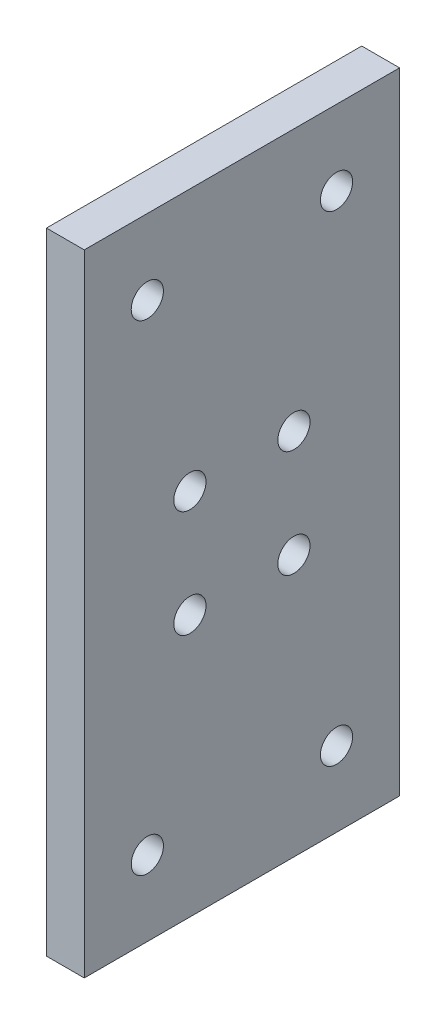
from build123d import *

# Parameters (mm, degrees)
SKETCH1_W           = 100
SKETCH1_H           = 50
SKETCH1_R           = 2.555
BOSS_EXTRUDE1_DEPTH = 6


with BuildPart() as part:
    # Sketch1 → Boss-Extrude1 (new body)
    with BuildSketch(Plane.YZ):
        Rectangle(SKETCH1_W, SKETCH1_H)
        with Locations((-8.5, 8.25)):
            Circle(SKETCH1_R, mode=Mode.SUBTRACT)
        with Locations((-8.5, -8.25)):
            Circle(SKETCH1_R, mode=Mode.SUBTRACT)
        with Locations((8.5, -8.25)):
            Circle(SKETCH1_R, mode=Mode.SUBTRACT)
        with Locations((8.5, 8.25)):
            Circle(SKETCH1_R, mode=Mode.SUBTRACT)
        with Locations((-38.1, 15)):
            Circle(SKETCH1_R, mode=Mode.SUBTRACT)
        with Locations((-38.1, -15)):
            Circle(SKETCH1_R, mode=Mode.SUBTRACT)
        with Locations((38.1, 15)):
            Circle(SKETCH1_R, mode=Mode.SUBTRACT)
        with Locations((38.1, -15)):
            Circle(SKETCH1_R, mode=Mode.SUBTRACT)
    extrude(amount=BOSS_EXTRUDE1_DEPTH)


solid = part.part
